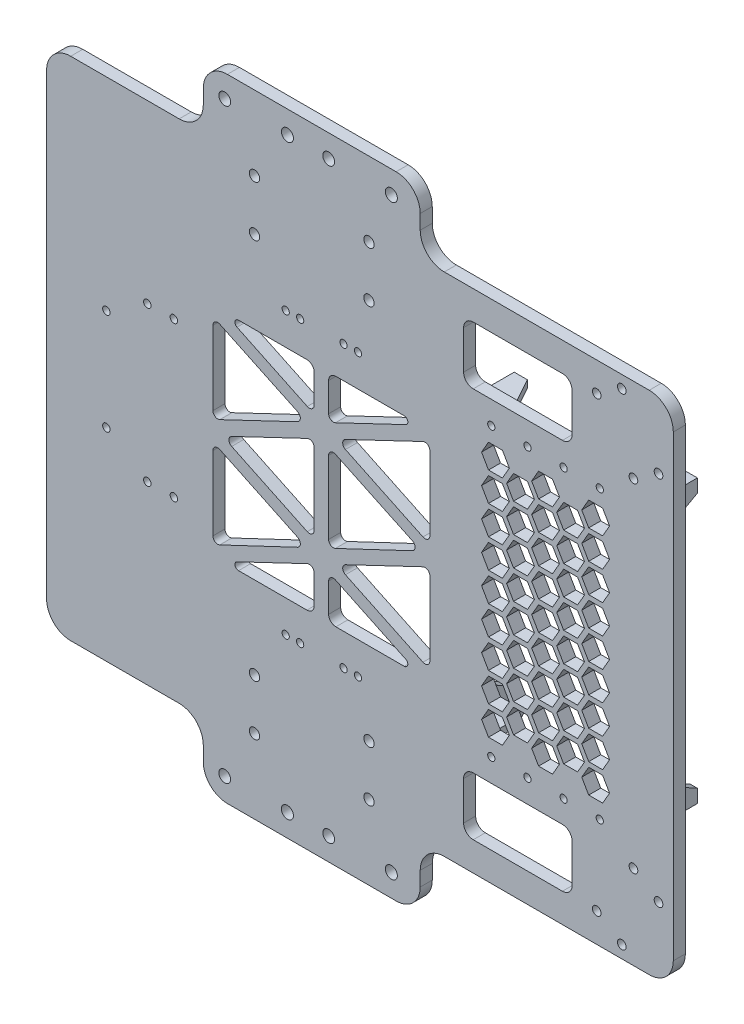
from build123d import *

# Parameters (mm, degrees)
EXTRUDE_1_DEPTH       = 5
EXTRUDE_2_DEPTH       = 20
CUT_EXTRUDE_3_DEPTH   = 10
CUT_EXTRUDE_4_DEPTH   = 10
MIRROR_2_COPY_1_DEPTH = 20
MIRROR_2_COPY_2_DEPTH = 10
MIRROR_2_COPY_3_DEPTH = 10
MIRROR_2_COPY_4_DEPTH = 20
MIRROR_2_COPY_5_DEPTH = 10
MIRROR_2_COPY_6_DEPTH = 10
CUT_EXTRUDE_5_DEPTH   = 5
SKETCH_9_W            = 45
SKETCH_9_H            = 24
CUT_EXTRUDE_6_DEPTH   = 5
FILLET_1_R            = 4
FILLET_2_R            = 1.5
FILLET_3_R            = 2
FILLET_4_R            = 3
SKETCH_10_R           = 1.8
SKETCH_10_R_2         = 1.55
SKETCH_10_R_3         = 2.5
SKETCH_10_R_4         = 2.45
SKETCH_10_R_5         = 1.5
SKETCH_10_R_6         = 2.15
CUT_EXTRUDE_7_DEPTH   = 186.636742053


with BuildPart() as part:
    # 草图1 → 凸台-拉伸1 (new body)
    with BuildSketch(Plane.XY):
        with BuildLine():
            Line((-130, 95), (-130, -95))
            ThreePointArc((-130, -95), (-127.071067812, -102.071067812), (-120, -105))
            Line((-120, -105), (-75, -105))
            ThreePointArc((-75, -105), (-67.928932188, -107.928932188), (-65, -115))
            Line((-65, -115), (-65, -121))
            ThreePointArc((-65, -121), (-62.071067812, -128.071067812), (-55, -131))
            Line((-55, -131), (15, -131))
            ThreePointArc((15, -131), (22.071067812, -128.071067812), (25, -121))
            Line((25, -121), (25, -115))
            ThreePointArc((25, -115), (27.928932188, -107.928932188), (35, -105))
            Line((35, -105), (120, -105))
            ThreePointArc((120, -105), (127.071067812, -102.071067812), (130, -95))
            Line((130, -95), (130, 95))
            ThreePointArc((130, 95), (127.071067812, 102.071067812), (120, 105))
            Line((120, 105), (35, 105))
            ThreePointArc((35, 105), (27.928932188, 107.928932188), (25, 115))
            Line((25, 115), (25, 121))
            ThreePointArc((25, 121), (22.071067812, 128.071067812), (15, 131))
            Line((15, 131), (-55, 131))
            ThreePointArc((-55, 131), (-62.071067812, 128.071067812), (-65, 121))
            Line((-65, 121), (-65, 115))
            ThreePointArc((-65, 115), (-67.928932188, 107.928932188), (-75, 105))
            Line((-75, 105), (-120, 105))
            ThreePointArc((-120, 105), (-127.071067812, 102.071067812), (-130, 95))
        make_face()
    extrude(amount=EXTRUDE_1_DEPTH)

    # 草图4 → 凸台-拉伸2 (add)
    with BuildSketch(Plane(origin=(0, 0, 0), x_dir=(-1, 0, 0), z_dir=(0, 0, -1))):
        Polygon((-39, -47.5), (-39, -58.5), (-50, -58.5), (-50, -55.5), (-42, -55.5), (-42, -47.5), align=None)
    extrude_2 = extrude(amount=EXTRUDE_2_DEPTH)

    # 草图5 → 切除-拉伸3 (cut)
    with BuildSketch(Plane.XZ.offset(58.5)):
        Polygon((50, -10), (44.5, -20), (50, -20), align=None)
    cut_extrude_3 = extrude(amount=-CUT_EXTRUDE_3_DEPTH, mode=Mode.SUBTRACT)

    # 草图6 → 切除-拉伸4 (cut)
    with BuildSketch(Plane.ZY.offset(-39)):
        Polygon((-20, -53), (-10, -47.5), (-20, -47.5), align=None)
    cut_extrude_4 = extrude(amount=-CUT_EXTRUDE_4_DEPTH, mode=Mode.SUBTRACT)

    # 镜向1: 凸台-拉伸2, 切除-拉伸3, 切除-拉伸4 across plane
    add(extrude_2.mirror(Plane(origin=(77, 0, 0), x_dir=(0, 0, 1), z_dir=(1, 0, 0))))
    add(cut_extrude_3.mirror(Plane(origin=(77, 0, 0), x_dir=(0, 0, 1), z_dir=(1, 0, 0))), mode=Mode.SUBTRACT)
    add(cut_extrude_4.mirror(Plane(origin=(77, 0, 0), x_dir=(0, 0, 1), z_dir=(1, 0, 0))), mode=Mode.SUBTRACT)

    # 镜向2 copy 1 sketch → 镜向2 copy 1 (add)
    with BuildSketch(Plane(origin=(154, 0, 0), x_dir=(1, 0, 0), z_dir=(0, 0, -1))):
        Polygon((-39, -47.5), (-39, -58.5), (-50, -58.5), (-50, -55.5), (-42, -55.5), (-42, -47.5), align=None)
    extrude(amount=MIRROR_2_COPY_1_DEPTH)

    # 镜向2 copy 2 sketch → 镜向2 copy 2 (cut)
    with BuildSketch(Plane(origin=(154, 58.5, 0), x_dir=(-1, 0, 0), z_dir=(0, 1, 0))):
        Polygon((50, -10), (44.5, -20), (50, -20), align=None)
    extrude(amount=-MIRROR_2_COPY_2_DEPTH, mode=Mode.SUBTRACT)

    # 镜向2 copy 3 sketch → 镜向2 copy 3 (cut)
    with BuildSketch(Plane(origin=(115, 0, 0), x_dir=(0, 0, 1), z_dir=(1, 0, 0))):
        Polygon((-20, -53), (-10, -47.5), (-20, -47.5), align=None)
    extrude(amount=-MIRROR_2_COPY_3_DEPTH, mode=Mode.SUBTRACT)

    # 镜向2 copy 4 sketch → 镜向2 copy 4 (add)
    with BuildSketch(Plane(origin=(0, 0, 0), x_dir=(-1, 0, 0), z_dir=(0, 0, -1))):
        Polygon((-39, 47.5), (-39, 58.5), (-50, 58.5), (-50, 55.5), (-42, 55.5), (-42, 47.5), align=None)
    extrude(amount=MIRROR_2_COPY_4_DEPTH)

    # 镜向2 copy 5 sketch → 镜向2 copy 5 (cut)
    with BuildSketch(Plane(origin=(0, 58.5, 0), x_dir=(1, 0, 0), z_dir=(0, 1, 0))):
        Polygon((50, 10), (44.5, 20), (50, 20), align=None)
    extrude(amount=-MIRROR_2_COPY_5_DEPTH, mode=Mode.SUBTRACT)

    # 镜向2 copy 6 sketch → 镜向2 copy 6 (cut)
    with BuildSketch(Plane.ZY.offset(-39)):
        Polygon((-20, 53), (-10, 47.5), (-20, 47.5), align=None)
    extrude(amount=-MIRROR_2_COPY_6_DEPTH, mode=Mode.SUBTRACT)

    # 草图7 → 切除-拉伸5 (cut)
    with BuildSketch(Plane(origin=(0, 0, 0), x_dir=(-1, 0, 0), z_dir=(0, 0, -1))):
        Polygon((-92.012994616, 36), (-94.899745962, 41), (-100.673248654, 41), (-103.56, 36), (-100.673248654, 31), (-94.899745962, 31), align=None)
        Polygon((-74.115136271, 31), (-71.228384925, 36), (-74.115136271, 41), (-79.888638963, 41), (-82.775390309, 36), (-79.888638963, 31), align=None)
        Polygon((-92.012994616, 24), (-94.899745962, 29), (-100.673248654, 29), (-103.56, 24), (-100.673248654, 19), (-94.899745962, 19), align=None)
        Polygon((-93.167695155, 30), (-90.280943809, 25), (-84.507441117, 25), (-81.620689771, 30), (-84.507441117, 35), (-90.280943809, 35), align=None)
        Polygon((-84.507441117, 37), (-81.620689771, 42), (-84.507441117, 47), (-90.280943809, 47), (-93.167695155, 42), (-90.280943809, 37), align=None)
        Polygon((-79.888638963, 43), (-74.115136271, 43), (-71.228384925, 48), (-74.115136271, 53), (-79.888638963, 53), (-82.775390309, 48), align=None)
        Polygon((-94.899745962, 43), (-92.012994616, 48), (-94.899745962, 53), (-100.673248654, 53), (-103.56, 48), (-100.673248654, 43), align=None)
        Polygon((-72.383085464, 42), (-69.496334118, 37), (-63.722831426, 37), (-60.83608008, 42), (-63.722831426, 47), (-69.496334118, 47), align=None)
        Polygon((-93.167695155, 18), (-90.280943809, 13), (-84.507441117, 13), (-81.620689771, 18), (-84.507441117, 23), (-90.280943809, 23), align=None)
        Polygon((-74.115136271, 19), (-71.228384925, 24), (-74.115136271, 29), (-79.888638963, 29), (-82.775390309, 24), (-79.888638963, 19), align=None)
        Polygon((-72.383085464, 30), (-69.496334118, 25), (-63.722831426, 25), (-60.83608008, 30), (-63.722831426, 35), (-69.496334118, 35), align=None)
        Polygon((-92.012994616, 12), (-94.899745962, 17), (-100.673248654, 17), (-103.56, 12), (-100.673248654, 7), (-94.899745962, 7), align=None)
        Polygon((-93.167695155, 6), (-90.280943809, 1), (-84.507441117, 1), (-81.620689771, 6), (-84.507441117, 11), (-90.280943809, 11), align=None)
        Polygon((-74.115136271, 7), (-71.228384925, 12), (-74.115136271, 17), (-79.888638963, 17), (-82.775390309, 12), (-79.888638963, 7), align=None)
        Polygon((-72.383085464, 18), (-69.496334118, 13), (-63.722831426, 13), (-60.83608008, 18), (-63.722831426, 23), (-69.496334118, 23), align=None)
        Polygon((-92.012994616, 0), (-94.899745962, 5), (-100.673248654, 5), (-103.56, 0), (-100.673248654, -5), (-94.899745962, -5), align=None)
        Polygon((-93.167695155, -6), (-90.280943809, -11), (-84.507441117, -11), (-81.620689771, -6), (-84.507441117, -1), (-90.280943809, -1), align=None)
        Polygon((-74.115136271, -5), (-71.228384925, 0), (-74.115136271, 5), (-79.888638963, 5), (-82.775390309, 0), (-79.888638963, -5), align=None)
        Polygon((-72.383085464, 6), (-69.496334118, 1), (-63.722831426, 1), (-60.83608008, 6), (-63.722831426, 11), (-69.496334118, 11), align=None)
        Polygon((-92.012994616, -12), (-94.899745962, -7), (-100.673248654, -7), (-103.56, -12), (-100.673248654, -17), (-94.899745962, -17), align=None)
        Polygon((-93.167695155, -18), (-90.280943809, -23), (-84.507441117, -23), (-81.620689771, -18), (-84.507441117, -13), (-90.280943809, -13), align=None)
        Polygon((-74.115136271, -17), (-71.228384925, -12), (-74.115136271, -7), (-79.888638963, -7), (-82.775390309, -12), (-79.888638963, -17), align=None)
        Polygon((-72.383085464, -6), (-69.496334118, -11), (-63.722831426, -11), (-60.83608008, -6), (-63.722831426, -1), (-69.496334118, -1), align=None)
        Polygon((-92.012994616, -24), (-94.899745962, -19), (-100.673248654, -19), (-103.56, -24), (-100.673248654, -29), (-94.899745962, -29), align=None)
        Polygon((-93.167695155, -30), (-90.280943809, -35), (-84.507441117, -35), (-81.620689771, -30), (-84.507441117, -25), (-90.280943809, -25), align=None)
        Polygon((-74.115136271, -29), (-71.228384925, -24), (-74.115136271, -19), (-79.888638963, -19), (-82.775390309, -24), (-79.888638963, -29), align=None)
        Polygon((-72.383085464, -18), (-69.496334118, -23), (-63.722831426, -23), (-60.83608008, -18), (-63.722831426, -13), (-69.496334118, -13), align=None)
        Polygon((-92.012994616, -36), (-94.899745962, -31), (-100.673248654, -31), (-103.56, -36), (-100.673248654, -41), (-94.899745962, -41), align=None)
        Polygon((-93.167695155, -42), (-90.280943809, -47), (-84.507441117, -47), (-81.620689771, -42), (-84.507441117, -37), (-90.280943809, -37), align=None)
        Polygon((-74.115136271, -41), (-71.228384925, -36), (-74.115136271, -31), (-79.888638963, -31), (-82.775390309, -36), (-79.888638963, -41), align=None)
        Polygon((-72.383085464, -30), (-69.496334118, -35), (-63.722831426, -35), (-60.83608008, -30), (-63.722831426, -25), (-69.496334118, -25), align=None)
        Polygon((-92.012994616, -48), (-94.899745962, -43), (-100.673248654, -43), (-103.56, -48), (-100.673248654, -53), (-94.899745962, -53), align=None)
        Polygon((-74.115136271, -53), (-71.228384925, -48), (-74.115136271, -43), (-79.888638963, -43), (-82.775390309, -48), (-79.888638963, -53), align=None)
        Polygon((-72.383085464, -42), (-69.496334118, -47), (-63.722831426, -47), (-60.83608008, -42), (-63.722831426, -37), (-69.496334118, -37), align=None)
        Polygon((-61.990780618, 36), (-59.104029272, 31), (-53.330526581, 31), (-50.443775235, 36), (-53.330526581, 41), (-59.104029272, 41), align=None)
        Polygon((-61.990780618, 48), (-59.104029272, 43), (-53.330526581, 43), (-50.443775235, 48), (-53.330526581, 53), (-59.104029272, 53), align=None)
        Polygon((-61.990780618, 24), (-59.104029272, 19), (-53.330526581, 19), (-50.443775235, 24), (-53.330526581, 29), (-59.104029272, 29), align=None)
        Polygon((-61.990780618, 12), (-59.104029272, 7), (-53.330526581, 7), (-50.443775235, 12), (-53.330526581, 17), (-59.104029272, 17), align=None)
        Polygon((-61.990780618, 0), (-59.104029272, -5), (-53.330526581, -5), (-50.443775235, 0), (-53.330526581, 5), (-59.104029272, 5), align=None)
        Polygon((-61.990780618, -12), (-59.104029272, -17), (-53.330526581, -17), (-50.443775235, -12), (-53.330526581, -7), (-59.104029272, -7), align=None)
        Polygon((-61.990780618, -24), (-59.104029272, -29), (-53.330526581, -29), (-50.443775235, -24), (-53.330526581, -19), (-59.104029272, -19), align=None)
        Polygon((-61.990780618, -36), (-59.104029272, -41), (-53.330526581, -41), (-50.443775235, -36), (-53.330526581, -31), (-59.104029272, -31), align=None)
        Polygon((-61.990780618, -48), (-59.104029272, -53), (-53.330526581, -53), (-50.443775235, -48), (-53.330526581, -43), (-59.104029272, -43), align=None)
    extrude(amount=-CUT_EXTRUDE_5_DEPTH, mode=Mode.SUBTRACT)

    # 草图9 → 切除-拉伸6 (cut)
    with BuildSketch(Plane(origin=(0, 0, 0), x_dir=(-1, 0, 0), z_dir=(0, 0, -1))):
        Polygon((9.804878049, 22.5), (-29, 41), (-29, 4), align=None)
        Polygon((13, -26.88372093), (-25, -45), (13, -45), align=None)
        Polygon((22.074593576, -22.557461202), (61, -41), (61, -4), align=None)
        Polygon((19, 26.88372093), (57, 45), (19, 45), align=None)
        Polygon((19, -18.11627907), (57, 0), (19, 18.11627907), align=None)
        with Locations((-65.5, 81)):
            Rectangle(SKETCH_9_W, SKETCH_9_H)
        with Locations((-65.5, -81)):
            Rectangle(SKETCH_9_W, SKETCH_9_H)
        Polygon((13, 45), (-25, 45), (13, 26.88372093), align=None)
        Polygon((61, 4), (61, 41), (22.074593576, 22.557461202), align=None)
        Polygon((13, 18.257993079), (-25.535898385, 0), (13, -18.257993079), align=None)
        Polygon((19, -45), (57, -45), (19, -26.88372093), align=None)
        Polygon((-29, -41), (9.804878049, -22.5), (-29, -4), align=None)
    extrude(amount=-CUT_EXTRUDE_6_DEPTH, mode=Mode.SUBTRACT)

    # 圆角1
    fillet_1_edges = [part.edges().sort_by_distance(p)[0] for p in [
        (43, -93, 2.5),
        (88, -69, 2.5),
        (43, -69, 2.5),
        (88, -93, 2.5),
        (88, 69, 2.5),
        (43, 69, 2.5),
        (43, 93, 2.5),
        (88, 93, 2.5),
    ]]
    fillet(fillet_1_edges, radius=FILLET_1_R)

    # 圆角2
    fillet_2_edges = [part.edges().sort_by_distance(p)[0] for p in [
        (25, -45, 2.5),
        (-57, -45, 2.5),
        (25, 45, 2.5),
        (-57, 45, 2.5),
    ]]
    fillet(fillet_2_edges, radius=FILLET_2_R)

    # 圆角3
    fillet_3_edges = [part.edges().sort_by_distance(p)[0] for p in [
        (29, -4, 2.5),
        (29, 4, 2.5),
        (-13, -18.257993079, 2.5),
        (-61, -41, 2.5),
        (-61, 4, 2.5),
        (-13, -26.88372093, 2.5),
        (-13, 18.257993079, 2.5),
        (-61, -4, 2.5),
        (-22.074593576, -22.557461202, 2.5),
        (25.535898385, 0, 2.5),
        (-22.074593576, 22.557461202, 2.5),
        (-61, 41, 2.5),
        (-19, 26.88372093, 2.5),
        (-19, -26.88372093, 2.5),
        (-19, -18.11627907, 2.5),
        (29, -41, 2.5),
        (29, 41, 2.5),
        (-57, 0, 2.5),
        (-9.804878049, -22.5, 2.5),
        (-13, 26.88372093, 2.5),
        (-9.804878049, 22.5, 2.5),
        (-19, 18.11627907, 2.5),
    ]]
    fillet(fillet_3_edges, radius=FILLET_3_R)

    # 圆角4
    fillet_4_edges = [part.edges().sort_by_distance(p)[0] for p in [
        (-13, -45, 2.5),
        (-13, 45, 2.5),
        (-19, -45, 2.5),
        (-19, 45, 2.5),
    ]]
    fillet(fillet_4_edges, radius=FILLET_4_R)

    # 草图10 → 切除-拉伸7 (cut, through all)
    with BuildSketch(Plane(origin=(0, 0, 0), x_dir=(-1, 0, 0), z_dir=(0, 0, -1))):
        with Locations((-123.874270778, 76.959685144)):
            Circle(SKETCH_10_R)
        with Locations((-113.46869275, 70.033362462)):
            Circle(SKETCH_10_R)
        with Locations((-108.636360878, 99.851956806)):
            Circle(SKETCH_10_R)
        with Locations((-98.23078285, 92.925634125)):
            Circle(SKETCH_10_R)
        with Locations((105.210066138, 21)):
            Circle(SKETCH_10_R_2)
        with Locations((88.210066138, 32)):
            Circle(SKETCH_10_R_2)
        with Locations((77.210066138, 32)):
            Circle(SKETCH_10_R_2)
        with Locations((-13.026746603, 121.678975654)):
            Circle(SKETCH_10_R_3)
        with Locations((56.094087389, 121.678975654)):
            Circle(SKETCH_10_R_4)
        with Locations((30.094087389, 121.678975654)):
            Circle(SKETCH_10_R_3)
        with Locations((12.973253397, 121.678975654)):
            Circle(SKETCH_10_R_4)
        with Locations((12.973253397, -121.678975654)):
            Circle(SKETCH_10_R_4)
        with Locations((30.094087389, -121.678975654)):
            Circle(SKETCH_10_R_3)
        with Locations((56.094087389, -121.678975654)):
            Circle(SKETCH_10_R_4)
        with Locations((-13.026746603, -121.678975654)):
            Circle(SKETCH_10_R_3)
        with Locations((77.210066138, -32)):
            Circle(SKETCH_10_R_2)
        with Locations((88.210066138, -32)):
            Circle(SKETCH_10_R_2)
        with Locations((105.210066138, -21)):
            Circle(SKETCH_10_R_2)
        with Locations((-98.23078285, -92.925634125)):
            Circle(SKETCH_10_R)
        with Locations((-108.636360878, -99.851956806)):
            Circle(SKETCH_10_R)
        with Locations((-113.46869275, -70.033362462)):
            Circle(SKETCH_10_R)
        with Locations((-123.874270778, -76.959685144)):
            Circle(SKETCH_10_R)
        with Locations((-99.5, 59.5)):
            Circle(SKETCH_10_R_5)
        with Locations((-84.5, 59.5)):
            Circle(SKETCH_10_R_5)
        with Locations((-69.5, 59.5)):
            Circle(SKETCH_10_R_5)
        with Locations((-54.5, 59.5)):
            Circle(SKETCH_10_R_5)
        with Locations((0.806057342, 58.25)):
            Circle(SKETCH_10_R_5)
        with Locations((6.806057342, 58.25)):
            Circle(SKETCH_10_R_5)
        with Locations((24.806057342, 58.25)):
            Circle(SKETCH_10_R_5)
        with Locations((30.806057342, 58.25)):
            Circle(SKETCH_10_R_5)
        with Locations((30.806057342, -58.25)):
            Circle(SKETCH_10_R_5)
        with Locations((24.806057342, -58.25)):
            Circle(SKETCH_10_R_5)
        with Locations((6.806057342, -58.25)):
            Circle(SKETCH_10_R_5)
        with Locations((0.806057342, -58.25)):
            Circle(SKETCH_10_R_5)
        with Locations((-54.5, -59.5)):
            Circle(SKETCH_10_R_5)
        with Locations((-69.5, -59.5)):
            Circle(SKETCH_10_R_5)
        with Locations((-84.5, -59.5)):
            Circle(SKETCH_10_R_5)
        with Locations((-99.5, -59.5)):
            Circle(SKETCH_10_R_5)
        with Locations((-3.75, 79.16647484)):
            Circle(SKETCH_10_R_6)
        with Locations((43.75, 79.16647484)):
            Circle(SKETCH_10_R_6)
        with Locations((43.75, 100.16647484)):
            Circle(SKETCH_10_R_6)
        with Locations((-3.75, 100.16647484)):
            Circle(SKETCH_10_R_6)
        with Locations((-3.75, -100.16647484)):
            Circle(SKETCH_10_R_6)
        with Locations((43.75, -100.16647484)):
            Circle(SKETCH_10_R_6)
        with Locations((43.75, -79.16647484)):
            Circle(SKETCH_10_R_6)
        with Locations((-3.75, -79.16647484)):
            Circle(SKETCH_10_R_6)
    extrude(amount=-CUT_EXTRUDE_7_DEPTH, mode=Mode.SUBTRACT)


solid = part.part
